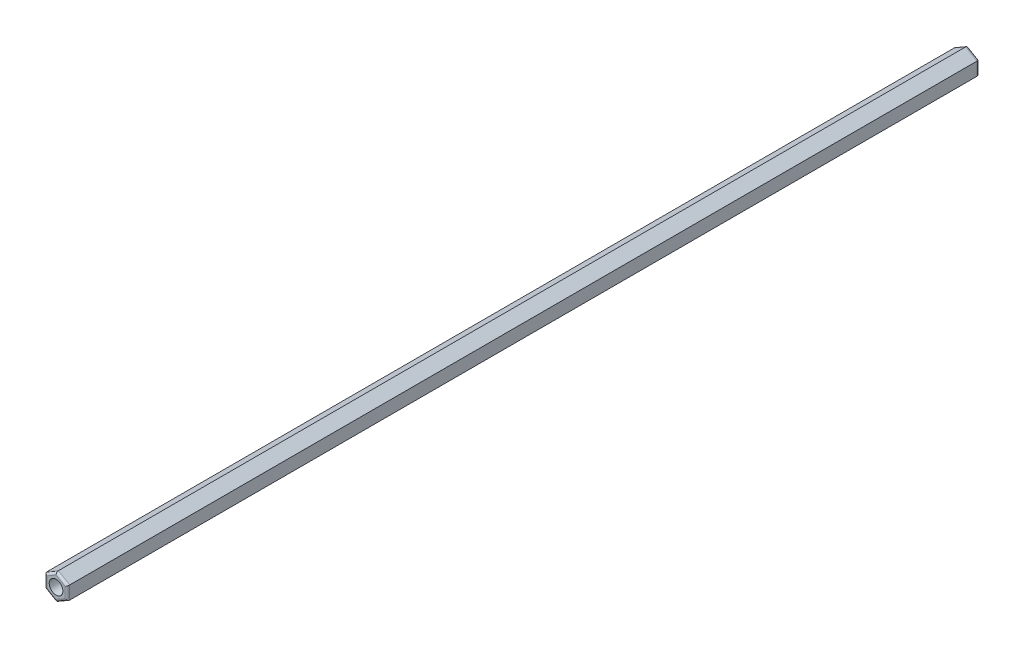
from build123d import *

# Parameters (mm, degrees)
RESSALTO_EXTRUS_O1_DEPTH = 200
FILETE1_R                = 0.5
ESBO_O2_R                = 1.5
CORTE_EXTRUS_O1_DEPTH    = 213.755472611


with BuildPart() as part:
    # Esboço1 → Ressalto-extrusão1 (new body)
    with BuildSketch(Plane(origin=(0, 0, 0), x_dir=(-1, 0, 0), z_dir=(0, 0, -1))):
        Polygon((67.502122675, -1.443375673), (70.002122675, -2.886751346), (72.502122675, -1.443375673), (72.502122675, 1.443375673), (70.002122675, 2.886751346), (67.502122675, 1.443375673), align=None)
    extrude(amount=-RESSALTO_EXTRUS_O1_DEPTH)

    # Filete1
    filete1_edges = [part.edges().sort_by_distance(p)[0] for p in [
        (-71.252122675, 2.165063509, 0),
        (-72.502122675, 0, 0),
        (-68.752122675, 2.165063509, 0),
        (-71.252122675, -2.165063509, 0),
        (-67.502122675, 0, 0),
        (-68.752122675, -2.165063509, 0),
        (-71.252122675, 2.165063509, 200),
        (-72.502122675, 0, 200),
        (-68.752122675, 2.165063509, 200),
        (-71.252122675, -2.165063509, 200),
        (-67.502122675, 0, 200),
        (-68.752122675, -2.165063509, 200),
    ]]
    fillet(filete1_edges, radius=FILETE1_R)

    # Esboço2 → Corte-extrusão1 (cut, through all)
    with BuildSketch(Plane.XY.offset(200)):
        with Locations((-70.002122675, 0)):
            Circle(ESBO_O2_R)
    extrude(amount=-CORTE_EXTRUS_O1_DEPTH, mode=Mode.SUBTRACT)


solid = part.part
